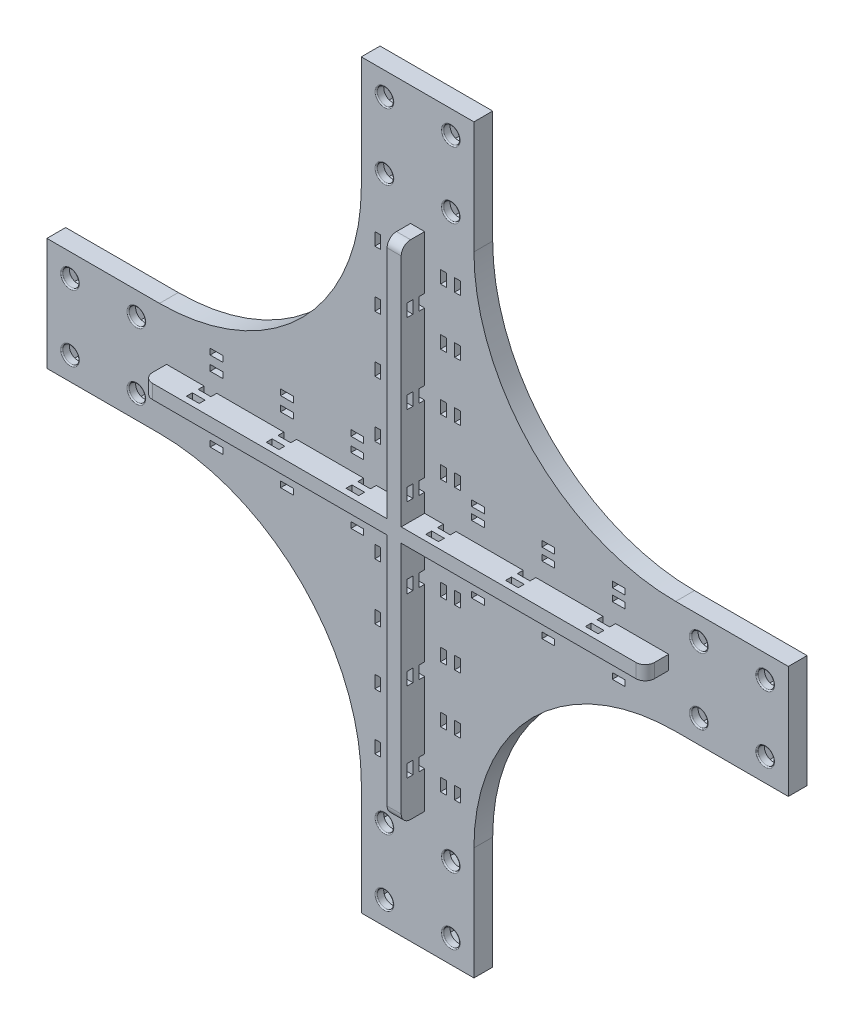
from build123d import *

# Parameters (mm, degrees)
BASE_OF_DRONE_DEPTH         = 4
SKETCH5_R                   = 1.75
SCREW_HOLES_DEPTH           = 4
SCREW_FILLET_R              = 0.25
DRONE_BASE_SPINE_DEPTH      = 5
DRONE_BASE_SPINE_FILLET_R   = 2
SKETCH8_W                   = 1.25
SKETCH8_H                   = 2.7
CABLE_TIE_HOLES_SET_1_DEPTH = 3
LPATTERN1_COUNT             = 6
LPATTERN1_PITCH             = 17
SKETCH9_W                   = 2.7
SKETCH9_H                   = 1.25
CABLE_TIE_HOLES_SET_2_DEPTH = 3
LPATTERN2_COUNT             = 6
LPATTERN2_PITCH             = 17
HEX_CUT_1_DEPTH             = 2.4
HEX_CUT_2_DEPTH             = 2.4
HEX_CUT_3_DEPTH             = 2.4
HEX_CUT_4_DEPTH             = 2.4
SKETCH14_W                  = 1.25
SKETCH14_H                  = 2.7
CUT_EXTRUDE8_DEPTH          = 4
LPATTERN3_COUNT             = 4
LPATTERN3_PITCH             = 12
SKETCH15_W                  = 1.25
SKETCH15_H                  = 2.7
CUT_EXTRUDE9_DEPTH          = 4
LPATTERN4_COUNT             = 4
LPATTERN4_PITCH             = 12
SKETCH16_W                  = 2.7
SKETCH16_H                  = 1.25
CUT_EXTRUDE10_DEPTH         = 4
LPATTERN5_COUNT             = 3
LPATTERN5_PITCH             = 15
SKETCH17_W                  = 2.7
SKETCH17_H                  = 1.25
CUT_EXTRUDE11_DEPTH         = 4
LPATTERN6_COUNT             = 3
LPATTERN6_PITCH             = 15


with BuildPart() as part:
    # Sketch4 → Base of drone (new body)
    with BuildSketch(Plane.XY):
        with BuildLine():
            Line((43.989426508, 19.050295585), (67.989426508, 19.050295585))
            Line((67.989426508, 19.050295585), (67.989426508, -4.949704415))
            ThreePointArc((67.989426508, -4.949704415), (80.583834917, -35.355296006), (110.989426508, -47.949704415))
            Line((110.989426508, -47.949704415), (134.989426508, -47.949704415))
            Line((134.989426508, -47.949704415), (134.989426508, -71.949704415))
            Line((134.989426508, -71.949704415), (110.989426508, -71.949704415))
            ThreePointArc((110.989426508, -71.949704415), (80.583834917, -84.544112824), (67.989426508, -114.949704415))
            Line((67.989426508, -114.949704415), (67.989426508, -138.949704415))
            Line((67.989426508, -138.949704415), (43.989426508, -138.949704415))
            Line((43.989426508, -138.949704415), (43.989426508, -114.949704415))
            ThreePointArc((43.989426508, -114.949704415), (31.395018099, -84.544112824), (0.989426508, -71.949704415))
            Line((0.989426508, -71.949704415), (-23.010573492, -71.949704415))
            Line((-23.010573492, -71.949704415), (-23.010573492, -47.949704415))
            Line((-23.010573492, -47.949704415), (0.989426508, -47.949704415))
            ThreePointArc((0.989426508, -47.949704415), (31.395018099, -35.355296006), (43.989426508, -4.949704415))
            Line((43.989426508, -4.949704415), (43.989426508, 19.050295585))
        make_face()
    extrude(amount=BASE_OF_DRONE_DEPTH)

    # Sketch5 → Screw holes (cut)
    with BuildSketch(Plane.XY.offset(4)):
        with Locations((48.918358696, 14.121363397)):
            Circle(SKETCH5_R)
        with Locations((63.06049432, 14.121363397)):
            Circle(SKETCH5_R)
        with Locations((63.06049432, -0.020772227)):
            Circle(SKETCH5_R)
        with Locations((48.918358696, -0.020772227)):
            Circle(SKETCH5_R)
        with Locations((-18.081641304, -52.878636603)):
            Circle(SKETCH5_R)
        with Locations((-3.93950568, -52.878636603)):
            Circle(SKETCH5_R)
        with Locations((-3.93950568, -67.020772227)):
            Circle(SKETCH5_R)
        with Locations((-18.081641304, -67.020772227)):
            Circle(SKETCH5_R)
        with Locations((48.918358696, -119.878636603)):
            Circle(SKETCH5_R)
        with Locations((63.06049432, -119.878636603)):
            Circle(SKETCH5_R)
        with Locations((63.06049432, -134.020772227)):
            Circle(SKETCH5_R)
        with Locations((48.918358696, -134.020772227)):
            Circle(SKETCH5_R)
        with Locations((115.918358696, -52.878636603)):
            Circle(SKETCH5_R)
        with Locations((130.06049432, -52.878636603)):
            Circle(SKETCH5_R)
        with Locations((115.918358696, -67.020772227)):
            Circle(SKETCH5_R)
        with Locations((130.06049432, -67.020772227)):
            Circle(SKETCH5_R)
    extrude(amount=-SCREW_HOLES_DEPTH, mode=Mode.SUBTRACT)

    # Screw fillet
    screw_fillet_edges = [part.edges().sort_by_distance(p)[0] for p in [
        (-5.68950568, -52.878636603, 4),
        (-5.68950568, -67.020772227, 4),
        (-19.831641304, -67.020772227, 4),
        (47.168358696, -119.878636603, 4),
        (-19.831641304, -52.878636603, 4),
        (47.168358696, -0.020772227, 4),
        (61.31049432, -0.020772227, 4),
        (61.31049432, 14.121363397, 4),
        (128.31049432, -52.878636603, 4),
        (114.168358696, -67.020772227, 4),
        (128.31049432, -67.020772227, 4),
        (61.31049432, -119.878636603, 4),
        (61.31049432, -134.020772227, 4),
        (47.168358696, -134.020772227, 4),
        (114.168358696, -52.878636603, 4),
        (47.168358696, 14.121363397, 4),
    ]]
    fillet(screw_fillet_edges, radius=SCREW_FILLET_R)

    # Sketch7 → Drone base spine (add)
    with BuildSketch(Plane.XY.offset(4)):
        Polygon((2.489426508, -58.449704415), (54.489426508, -58.449704415), (54.489426508, -6.449704415), (57.489426508, -6.449704415), (57.489426508, -58.449704415), (109.489426508, -58.449704415), (109.489426508, -61.449704415), (57.489426508, -61.449704415), (57.489426508, -113.449704415), (54.489426508, -113.449704415), (54.489426508, -61.449704415), (2.489426508, -61.449704415), align=None)
    extrude(amount=DRONE_BASE_SPINE_DEPTH)

    # Drone base spine fillet
    drone_base_spine_fillet_edges = [part.edges().sort_by_distance(p)[0] for p in [
        (109.489426508, -59.949704415, 9),
        (55.989426508, -6.449704415, 9),
        (2.489426508, -59.949704415, 9),
        (55.989426508, -113.449704415, 9),
    ]]
    fillet(drone_base_spine_fillet_edges, radius=DRONE_BASE_SPINE_FILLET_R)

    # Sketch8 → Cable tie holes set 1 (cut)
    with BuildSketch(Plane(origin=(57.489426508, 0, 0), x_dir=(0, 0, -1), z_dir=(1, 0, 0))):
        with Locations((-7.125, -104.099704415)):
            Rectangle(SKETCH8_W, SKETCH8_H)
        with Locations((-4.625, -104.199704415)):
            Rectangle(SKETCH8_W, SKETCH8_H)
    cable_tie_holes_set_1 = extrude(amount=-CABLE_TIE_HOLES_SET_1_DEPTH, mode=Mode.SUBTRACT)

    # LPattern1: Cable tie holes set 1 ×6
    with Locations(*[(0, i * LPATTERN1_PITCH, 0) for i in range(1, LPATTERN1_COUNT)]):
        add(cable_tie_holes_set_1, mode=Mode.SUBTRACT)

    # Sketch9 → Cable tie holes set 2 (cut)
    with BuildSketch(Plane(origin=(0, -61.449704415, 0), x_dir=(-1, 0, 0), z_dir=(0, -1, 0))):
        with Locations((-11.839426508, -7.125)):
            Rectangle(SKETCH9_W, SKETCH9_H)
        with Locations((-11.839426508, -4.625)):
            Rectangle(SKETCH9_W, SKETCH9_H)
    cable_tie_holes_set_2 = extrude(amount=-CABLE_TIE_HOLES_SET_2_DEPTH, mode=Mode.SUBTRACT)

    # LPattern2: Cable tie holes set 2 ×6
    with Locations(*[(i * LPATTERN2_PITCH, 0, 0) for i in range(1, LPATTERN2_COUNT)]):
        add(cable_tie_holes_set_2, mode=Mode.SUBTRACT)

    # Sketch10 → Hex cut 1 (cut)
    with BuildSketch(Plane(origin=(0, 0, 0), x_dir=(-1, 0, 0), z_dir=(0, 0, -1))):
        Polygon((-127.116007947, -52.878636603), (-128.588251134, -50.328636603), (-131.532737506, -50.328636603), (-133.004980693, -52.878636603), (-131.532737506, -55.428636603), (-128.588251134, -55.428636603), align=None)
        Polygon((-112.973872323, -52.878636603), (-114.44611551, -50.328636603), (-117.390601883, -50.328636603), (-118.862845069, -52.878636603), (-117.390601883, -55.428636603), (-114.44611551, -55.428636603), align=None)
        Polygon((-127.116007947, -67.020772227), (-128.588251134, -64.470772227), (-131.532737506, -64.470772227), (-133.004980693, -67.020772227), (-131.532737506, -69.570772227), (-128.588251134, -69.570772227), align=None)
        Polygon((-112.973872323, -67.020772227), (-114.44611551, -64.470772227), (-117.390601883, -64.470772227), (-118.862845069, -67.020772227), (-117.390601883, -69.570772227), (-114.44611551, -69.570772227), align=None)
    extrude(amount=-HEX_CUT_1_DEPTH, mode=Mode.SUBTRACT)

    # Sketch11 → Hex cut 2 (cut)
    with BuildSketch(Plane(origin=(0, 0, 0), x_dir=(-1, 0, 0), z_dir=(0, 0, -1))):
        Polygon((-60.116007947, 14.121363397), (-61.588251134, 16.671363397), (-64.532737506, 16.671363397), (-66.004980693, 14.121363397), (-64.532737506, 11.571363397), (-61.588251134, 11.571363397), align=None)
        Polygon((-47.44611551, 11.571363397), (-45.973872323, 14.121363397), (-47.44611551, 16.671363397), (-50.390601883, 16.671363397), (-51.862845069, 14.121363397), (-50.390601883, 11.571363397), align=None)
        Polygon((-60.116007947, -0.020772227), (-61.588251134, 2.529227773), (-64.532737506, 2.529227773), (-66.004980693, -0.020772227), (-64.532737506, -2.570772227), (-61.588251134, -2.570772227), align=None)
        Polygon((-45.973872323, -0.020772227), (-47.44611551, 2.529227773), (-50.390601883, 2.529227773), (-51.862845069, -0.020772227), (-50.390601883, -2.570772227), (-47.44611551, -2.570772227), align=None)
    extrude(amount=-HEX_CUT_2_DEPTH, mode=Mode.SUBTRACT)

    # Sketch12 → Hex cut 3 (cut)
    with BuildSketch(Plane(origin=(0, 0, 0), x_dir=(-1, 0, 0), z_dir=(0, 0, -1))):
        Polygon((6.883992053, -52.878636603), (5.411748866, -50.328636603), (2.467262494, -50.328636603), (0.995019307, -52.878636603), (2.467262494, -55.428636603), (5.411748866, -55.428636603), align=None)
        Polygon((21.026127677, -52.878636603), (19.55388449, -50.328636603), (16.609398117, -50.328636603), (15.137154931, -52.878636603), (16.609398117, -55.428636603), (19.55388449, -55.428636603), align=None)
        Polygon((6.883992053, -67.020772227), (5.411748866, -64.470772227), (2.467262494, -64.470772227), (0.995019307, -67.020772227), (2.467262494, -69.570772227), (5.411748866, -69.570772227), align=None)
        Polygon((21.026127677, -67.020772227), (19.55388449, -64.470772227), (16.609398117, -64.470772227), (15.137154931, -67.020772227), (16.609398117, -69.570772227), (19.55388449, -69.570772227), align=None)
    extrude(amount=-HEX_CUT_3_DEPTH, mode=Mode.SUBTRACT)

    # Sketch13 → Hex cut 4 (cut)
    with BuildSketch(Plane(origin=(0, 0, 0), x_dir=(-1, 0, 0), z_dir=(0, 0, -1))):
        Polygon((-60.51049432, -121.35087979), (-60.51049432, -118.406393417), (-63.06049432, -116.93415023), (-65.61049432, -118.406393417), (-65.61049432, -121.35087979), (-63.06049432, -122.823122976), align=None)
        Polygon((-48.918358696, -116.93415023), (-51.468358696, -118.406393417), (-51.468358696, -121.35087979), (-48.918358696, -122.823122976), (-46.368358696, -121.35087979), (-46.368358696, -118.406393417), align=None)
        Polygon((-48.918358696, -131.076285854), (-51.468358696, -132.54852904), (-51.468358696, -135.493015413), (-48.918358696, -136.9652586), (-46.368358696, -135.493015413), (-46.368358696, -132.54852904), align=None)
        Polygon((-63.06049432, -131.076285854), (-65.61049432, -132.54852904), (-65.61049432, -135.493015413), (-63.06049432, -136.9652586), (-60.51049432, -135.493015413), (-60.51049432, -132.54852904), align=None)
    extrude(amount=-HEX_CUT_4_DEPTH, mode=Mode.SUBTRACT)

    # Sketch14 → Cut-Extrude8 (cut)
    with BuildSketch(Plane.XY.offset(4)):
        with Locations((47.489426508, -49.099704415)):
            Rectangle(SKETCH14_W, SKETCH14_H)
        with Locations((50.489426508, -49.099704415)):
            Rectangle(SKETCH14_W, SKETCH14_H)
        with Locations((61.489426508, -49.099704415)):
            Rectangle(SKETCH14_W, SKETCH14_H)
        with Locations((64.489426508, -49.099704415)):
            Rectangle(SKETCH14_W, SKETCH14_H)
    cut_extrude8 = extrude(amount=-CUT_EXTRUDE8_DEPTH, mode=Mode.SUBTRACT)

    # LPattern3: Cut-Extrude8 ×4
    with Locations(*[(0, i * LPATTERN3_PITCH, 0) for i in range(1, LPATTERN3_COUNT)]):
        add(cut_extrude8, mode=Mode.SUBTRACT)

    # Sketch15 → Cut-Extrude9 (cut)
    with BuildSketch(Plane.XY.offset(4)):
        with Locations((47.489426508, -70.799704415)):
            Rectangle(SKETCH15_W, SKETCH15_H)
        with Locations((50.489426508, -70.799704415)):
            Rectangle(SKETCH15_W, SKETCH15_H)
        with Locations((61.489426508, -70.799704415)):
            Rectangle(SKETCH15_W, SKETCH15_H)
        with Locations((64.489426508, -70.799704415)):
            Rectangle(SKETCH15_W, SKETCH15_H)
    cut_extrude9 = extrude(amount=-CUT_EXTRUDE9_DEPTH, mode=Mode.SUBTRACT)

    # LPattern4: Cut-Extrude9 ×4
    with Locations(*[(0, -i * LPATTERN4_PITCH, 0) for i in range(1, LPATTERN4_COUNT)]):
        add(cut_extrude9, mode=Mode.SUBTRACT)

    # Sketch16 → Cut-Extrude10 (cut)
    with BuildSketch(Plane.XY.offset(4)):
        with Locations((43.139426508, -51.449704415)):
            Rectangle(SKETCH16_W, SKETCH16_H)
        with Locations((43.139426508, -54.449704415)):
            Rectangle(SKETCH16_W, SKETCH16_H)
        with Locations((43.139426508, -65.449704415)):
            Rectangle(SKETCH16_W, SKETCH16_H)
        with Locations((43.139426508, -68.449704415)):
            Rectangle(SKETCH16_W, SKETCH16_H)
    cut_extrude10 = extrude(amount=-CUT_EXTRUDE10_DEPTH, mode=Mode.SUBTRACT)

    # LPattern5: Cut-Extrude10 ×3
    with Locations(*[(-i * LPATTERN5_PITCH, 0, 0) for i in range(1, LPATTERN5_COUNT)]):
        add(cut_extrude10, mode=Mode.SUBTRACT)

    # Sketch17 → Cut-Extrude11 (cut)
    with BuildSketch(Plane.XY.offset(4)):
        with Locations((68.839426508, -51.559767838)):
            Rectangle(SKETCH17_W, SKETCH17_H)
        with Locations((68.839426508, -54.12117655)):
            Rectangle(SKETCH17_W, SKETCH17_H)
        with Locations((68.839426508, -65.449704415)):
            Rectangle(SKETCH17_W, SKETCH17_H)
        with Locations((68.839426508, -68.449704415)):
            Rectangle(SKETCH17_W, SKETCH17_H)
    cut_extrude11 = extrude(amount=-CUT_EXTRUDE11_DEPTH, mode=Mode.SUBTRACT)

    # LPattern6: Cut-Extrude11 ×3
    with Locations(*[(i * LPATTERN6_PITCH, 0, 0) for i in range(1, LPATTERN6_COUNT)]):
        add(cut_extrude11, mode=Mode.SUBTRACT)


solid = part.part
